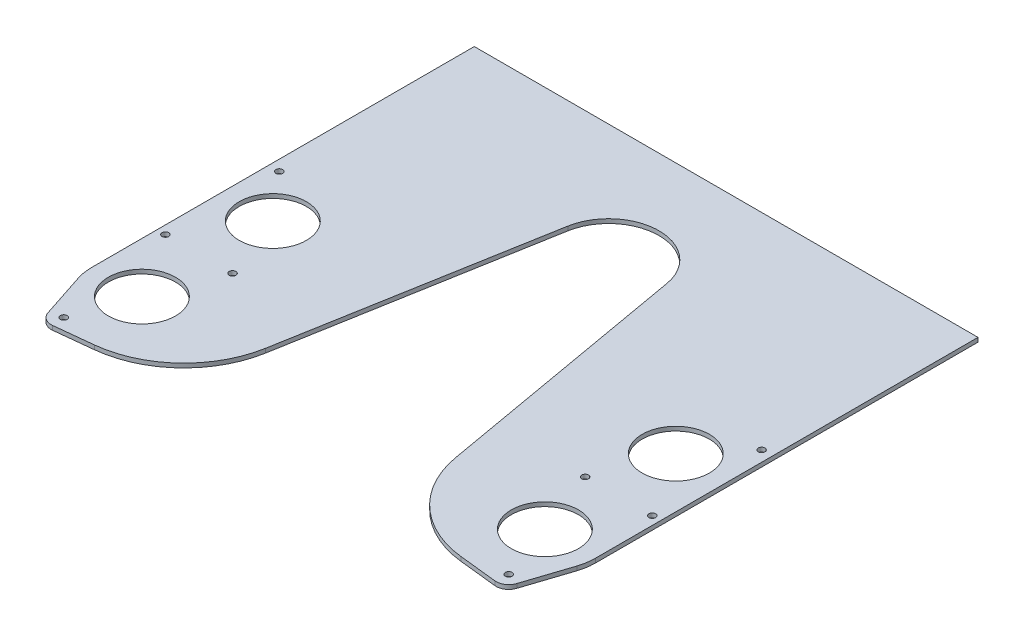
from build123d import *

# Parameters (mm, degrees)
SKETCH1_R           = 25.4
SKETCH1_R_2         = 2.5527
BOSS_EXTRUDE1_DEPTH = 3.175


with BuildPart() as part:
    # Sketch1 → Boss-Extrude1 (new body)
    with BuildSketch(Plane(origin=(0, 0, 0), x_dir=(1, 0, 0), z_dir=(0, 1, 0))):
        with BuildLine():
            Line((0, 0), (-381, 0))
            Line((-381, 0), (-381, -289.5092))
            ThreePointArc((-381, -289.5092), (-380.520716157, -295.533460602), (-379.094923055, -301.406155284))
            Line((-379.094923055, -301.406155284), (-367.823730764, -335.697276666))
            ThreePointArc((-367.823730764, -335.697276666), (-363.940671355, -340.725628953), (-357.759481824, -342.193747841))
            Line((-357.759481824, -342.193747841), (-329.202169799, -339.131625841))
            ThreePointArc((-329.202169799, -339.131625841), (-285.2995713, -319.040517428), (-262.283964431, -276.597937009))
            Line((-262.283964431, -276.597937009), (-228.02117539, -82.284004431))
            ThreePointArc((-228.02117539, -82.284004431), (-190.5, -50.8), (-152.97882461, -82.284004431))
            Line((-152.97882461, -82.284004431), (-118.716035569, -276.597937009))
            ThreePointArc((-118.716035569, -276.597937009), (-95.7004287, -319.040517428), (-51.797830201, -339.131625841))
            Line((-51.797830201, -339.131625841), (-23.240518176, -342.193747841))
            ThreePointArc((-23.240518176, -342.193747841), (-17.059328645, -340.725628953), (-13.176269236, -335.697276666))
            Line((-13.176269236, -335.697276666), (-1.905076945, -301.406155284))
            ThreePointArc((-1.905076945, -301.406155284), (-0.479283843, -295.533460602), (0, -289.5092))
            Line((0, -289.5092), (0, 0))
        make_face()
        with Locations((-342.9, -190.5)):
            Circle(SKETCH1_R, mode=Mode.SUBTRACT)
        with Locations((-372.894929259, -155.575)):
            Circle(SKETCH1_R_2, mode=Mode.SUBTRACT)
        with Locations((-342.9, -289.5092)):
            Circle(SKETCH1_R, mode=Mode.SUBTRACT)
        with Locations((-358.775, -332.723037844)):
            Circle(SKETCH1_R_2, mode=Mode.SUBTRACT)
        with Locations((-374.65, -240.0046)):
            Circle(SKETCH1_R_2, mode=Mode.SUBTRACT)
        with Locations((-323.85, -240.0046)):
            Circle(SKETCH1_R_2, mode=Mode.SUBTRACT)
        with Locations((-57.15, -240.0046)):
            Circle(SKETCH1_R_2, mode=Mode.SUBTRACT)
        with Locations((-6.35, -240.0046)):
            Circle(SKETCH1_R_2, mode=Mode.SUBTRACT)
        with Locations((-22.225, -332.723037844)):
            Circle(SKETCH1_R_2, mode=Mode.SUBTRACT)
        with Locations((-38.1, -289.5092)):
            Circle(SKETCH1_R, mode=Mode.SUBTRACT)
        with Locations((-8.105070741, -155.575)):
            Circle(SKETCH1_R_2, mode=Mode.SUBTRACT)
        with Locations((-38.1, -190.5)):
            Circle(SKETCH1_R, mode=Mode.SUBTRACT)
    extrude(amount=BOSS_EXTRUDE1_DEPTH)


solid = part.part
